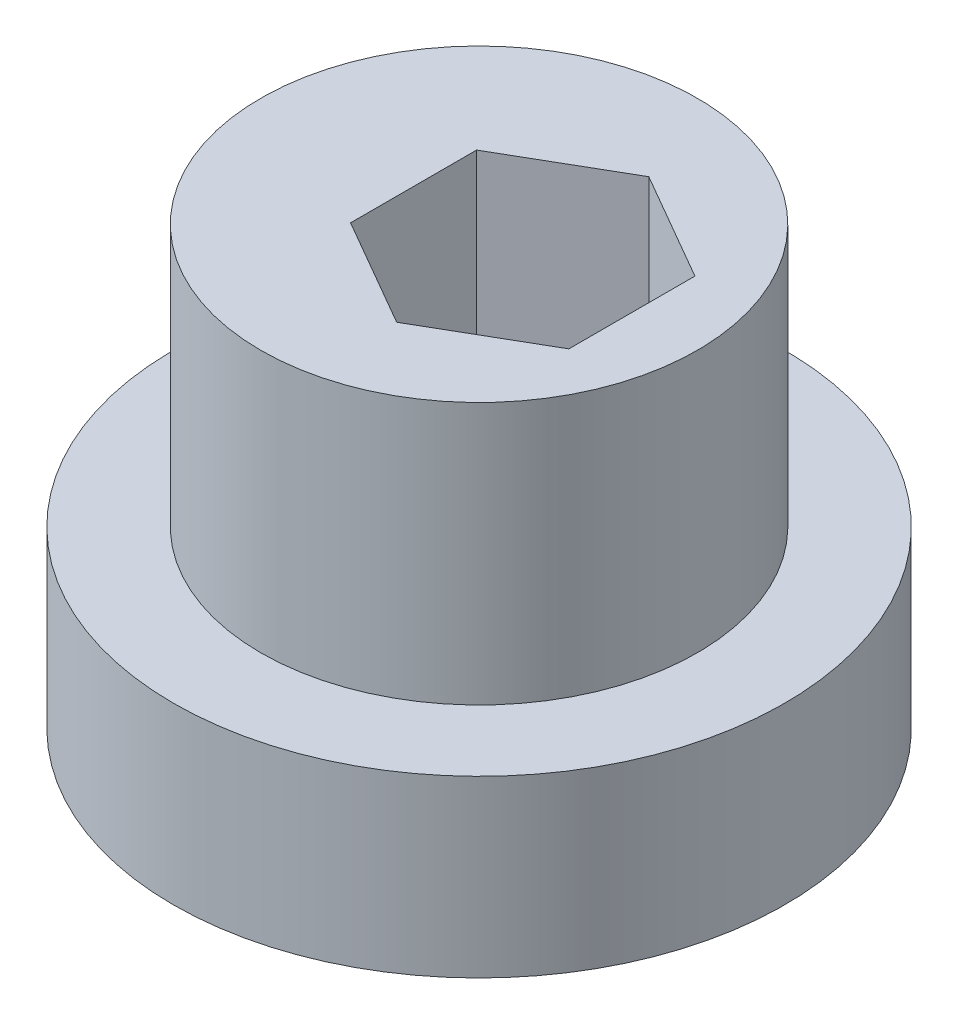
from build123d import *

# Parameters (mm, degrees)
SKETCH1_R           = 7
BOSS_EXTRUDE1_DEPTH = 4
SKETCH2_R           = 5
BOSS_EXTRUDE2_DEPTH = 6
CUT_EXTRUDE1_DEPTH  = 15.071247279


with BuildPart() as part:
    # Sketch1 → Boss-Extrude1 (new body)
    with BuildSketch(Plane(origin=(0, 0, 0), x_dir=(1, 0, 0), z_dir=(0, 1, 0))):
        Circle(SKETCH1_R)
    extrude(amount=BOSS_EXTRUDE1_DEPTH)

    # Sketch2 → Boss-Extrude2 (add)
    with BuildSketch(Plane(origin=(0, 4, 0), x_dir=(1, 0, 0), z_dir=(0, 1, 0))):
        Circle(SKETCH2_R)
    extrude(amount=BOSS_EXTRUDE2_DEPTH)

    # Sketch3 → Cut-Extrude1 (cut, through all)
    with BuildSketch(Plane(origin=(0, 10, 0), x_dir=(1, 0, 0), z_dir=(0, 1, 0))):
        Polygon((3.5, -1.443375673), (3.5, 1.443375673), (1, 2.886751346), (-1.5, 1.443375673), (-1.5, -1.443375673), (1, -2.886751346), align=None)
    extrude(amount=-CUT_EXTRUDE1_DEPTH, mode=Mode.SUBTRACT)


solid = part.part
